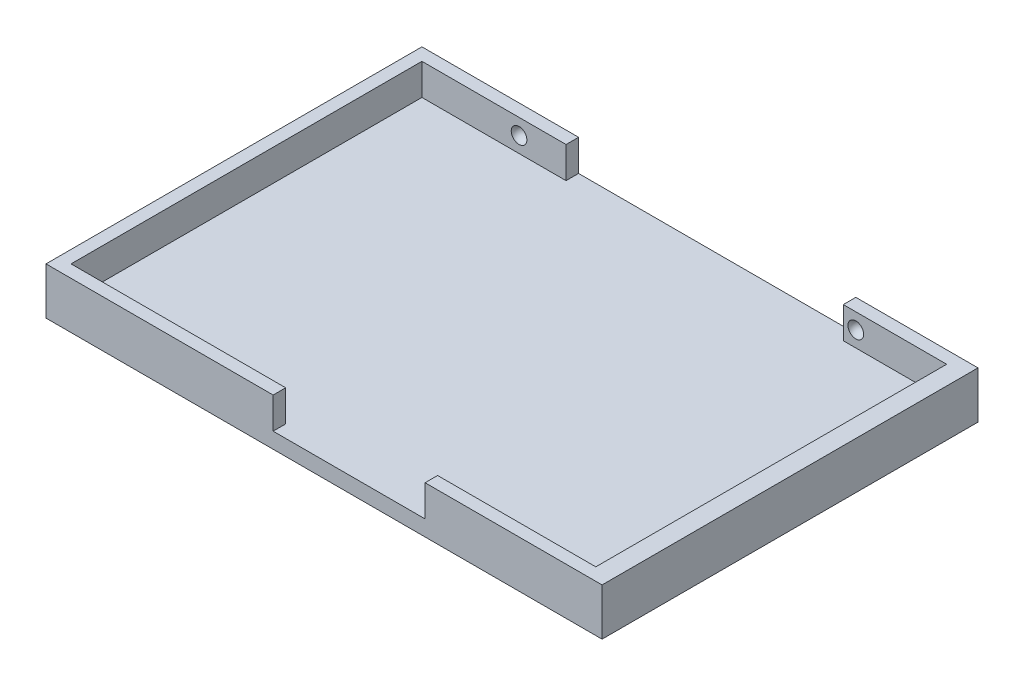
from build123d import *

# Parameters (mm, degrees)
SKETCH_1_W          = 35.5
SKETCH_1_H          = 24
EXTRUDE_1_DEPTH     = 3
SKETCH_2_W          = 33.5
SKETCH_2_H          = 22.4
CUT_EXTRUDE_1_DEPTH = 2
SKETCH_4_W          = 9.7
SKETCH_4_H          = 0.8
CUT_EXTRUDE_2_DEPTH = 2
SKETCH_5_W          = 17.7
SKETCH_5_H          = 0.8
CUT_EXTRUDE_3_DEPTH = 2


with BuildPart() as part:
    # 草图1 → 凸台-拉伸1 (new body)
    with BuildSketch(Plane(origin=(0, 0, 0), x_dir=(1, 0, 0), z_dir=(0, 1, 0))):
        Rectangle(SKETCH_1_W, SKETCH_1_H)
    extrude(amount=EXTRUDE_1_DEPTH)

    # 草图2 → 切除-拉伸1 (cut)
    with BuildSketch(Plane(origin=(0, 3, 0), x_dir=(1, 0, 0), z_dir=(0, 1, 0))):
        with Locations((-0.2, 0)):
            Rectangle(SKETCH_2_W, SKETCH_2_H)
    extrude(amount=-CUT_EXTRUDE_1_DEPTH, mode=Mode.SUBTRACT)

    # 草图4 → 切除-拉伸2 (cut)
    with BuildSketch(Plane(origin=(0, 3, 0), x_dir=(1, 0, 0), z_dir=(0, 1, 0))):
        with Locations((1.6, -11.6)):
            Rectangle(SKETCH_4_W, SKETCH_4_H)
    extrude(amount=-CUT_EXTRUDE_2_DEPTH, mode=Mode.SUBTRACT)

    # 草图5 → 切除-拉伸3 (cut)
    with BuildSketch(Plane(origin=(0, 3, 0), x_dir=(1, 0, 0), z_dir=(0, 1, 0))):
        with Locations((1.1, 11.6)):
            Rectangle(SKETCH_5_W, SKETCH_5_H)
    extrude(amount=-CUT_EXTRUDE_3_DEPTH, mode=Mode.SUBTRACT)

    # 草图6 → 切除-旋转1 (revolve, cut)
    with BuildSketch(Plane(origin=(0, 0, 11.2), x_dir=(-1, 0, 0), z_dir=(0, 0, -1))):
        with BuildLine():
            Line((-10.25, 2), (-11.25, 2))
            ThreePointArc((-11.25, 2), (-10.75, 2.5), (-10.25, 2))
        make_face()
        with BuildLine():
            Line((10.25, 2), (11.25, 2))
            ThreePointArc((11.25, 2), (10.75, 2.5), (10.25, 2))
        make_face()
    revolve(axis=Axis((10.25, 2, 11.2), (1, 0, 0)), mode=Mode.SUBTRACT)

    # 草图7 → 切除-旋转2 (revolve, cut)
    with BuildSketch(Plane.XY.offset(-11.2)):
        with BuildLine():
            Line((-10.25, 2), (-11.25, 2))
            ThreePointArc((-11.25, 2), (-10.75, 2.5), (-10.25, 2))
        make_face()
        with BuildLine():
            Line((10.25, 2), (11.25, 2))
            ThreePointArc((11.25, 2), (10.75, 2.5), (10.25, 2))
        make_face()
    revolve(axis=Axis((-10.25, 2, -11.2), (-1, 0, 0)), mode=Mode.SUBTRACT)


solid = part.part
